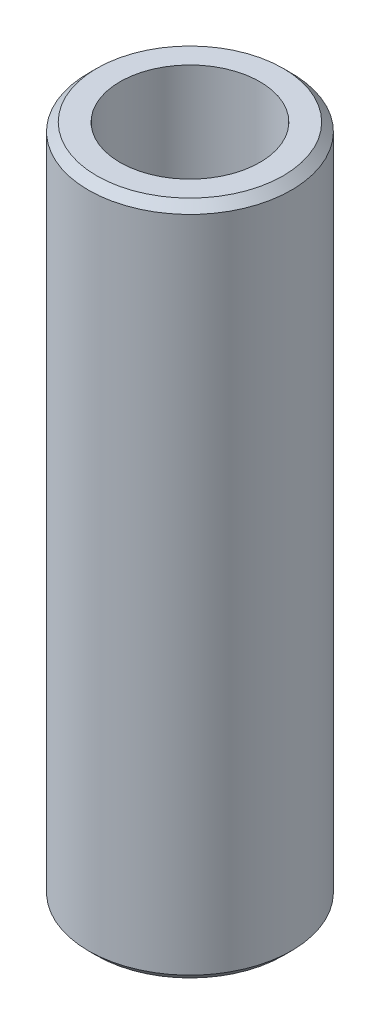
from build123d import *

# Parameters (mm, degrees)
SKETCH1_R           = 12.5
BOSS_EXTRUDE1_DEPTH = 83.225226521
SKETCH2_R           = 8.620680549
CUT_EXTRUDE1_DEPTH  = 86.081950668
CHAMFER1_SIZE       = 1.020751639


with BuildPart() as part:
    # Sketch1 → Boss-Extrude1 (new body)
    with BuildSketch(Plane(origin=(0, 0, 0), x_dir=(1, 0, 0), z_dir=(0, 1, 0))):
        Circle(SKETCH1_R)
    extrude(amount=BOSS_EXTRUDE1_DEPTH)

    # Sketch2 → Cut-Extrude1 (cut, through all)
    with BuildSketch(Plane(origin=(0, 0, 0), x_dir=(1, 0, 0), z_dir=(0, 1, 0))):
        Circle(SKETCH2_R)
    extrude(amount=CUT_EXTRUDE1_DEPTH, mode=Mode.SUBTRACT)

    # Chamfer1
    chamfer1_edges = [part.edges().sort_by_distance(p)[0] for p in [
        (-12.5, 83.225226521, 0),
        (-12.5, 0, 0),
    ]]
    chamfer(chamfer1_edges, length=CHAMFER1_SIZE)


solid = part.part
